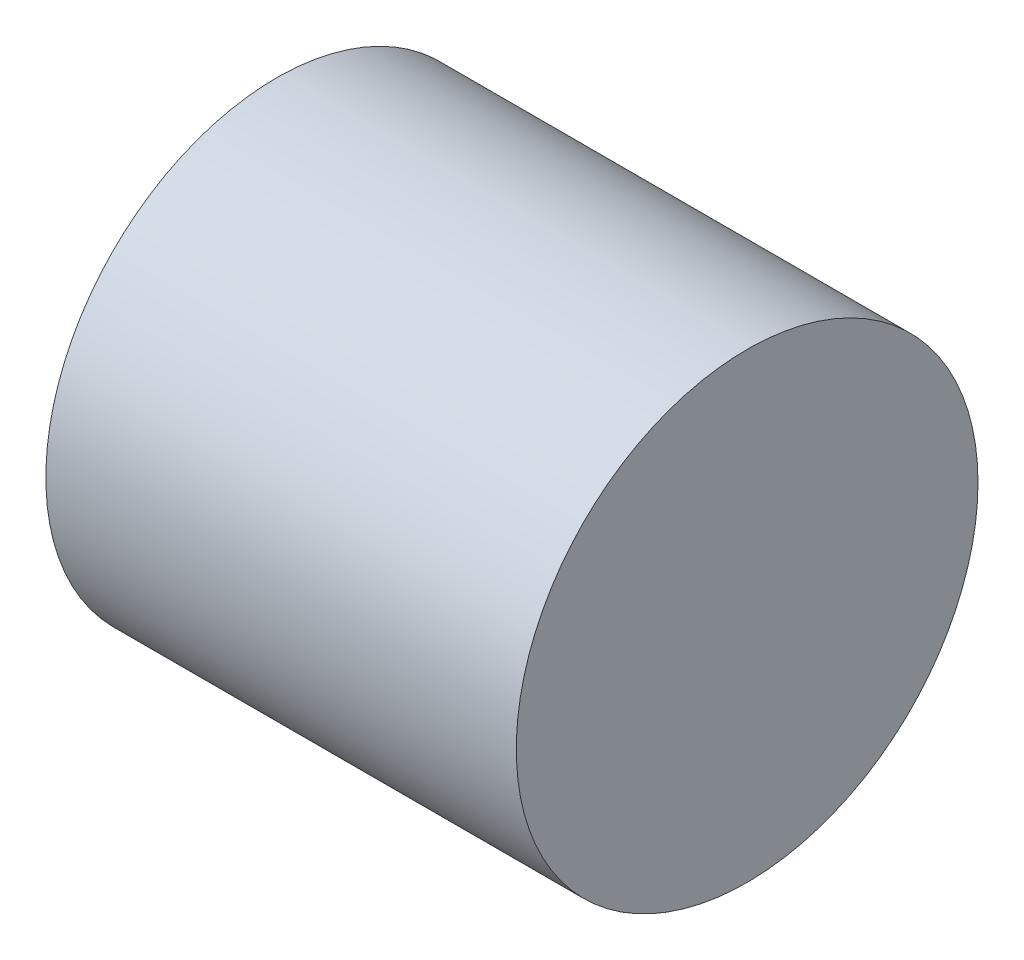
from build123d import *

# Parameters (mm, degrees)
ESQUISSE1_R        = 73.61
BOSS_EXTRU_1_DEPTH = 150


with BuildPart() as part:
    # Esquisse1 → Boss.-Extru.1 (new body)
    with BuildSketch(Plane(origin=(0, 0, 0), x_dir=(0, 0, -1), z_dir=(1, 0, 0))):
        Circle(ESQUISSE1_R)
    extrude(amount=BOSS_EXTRU_1_DEPTH)


solid = part.part
